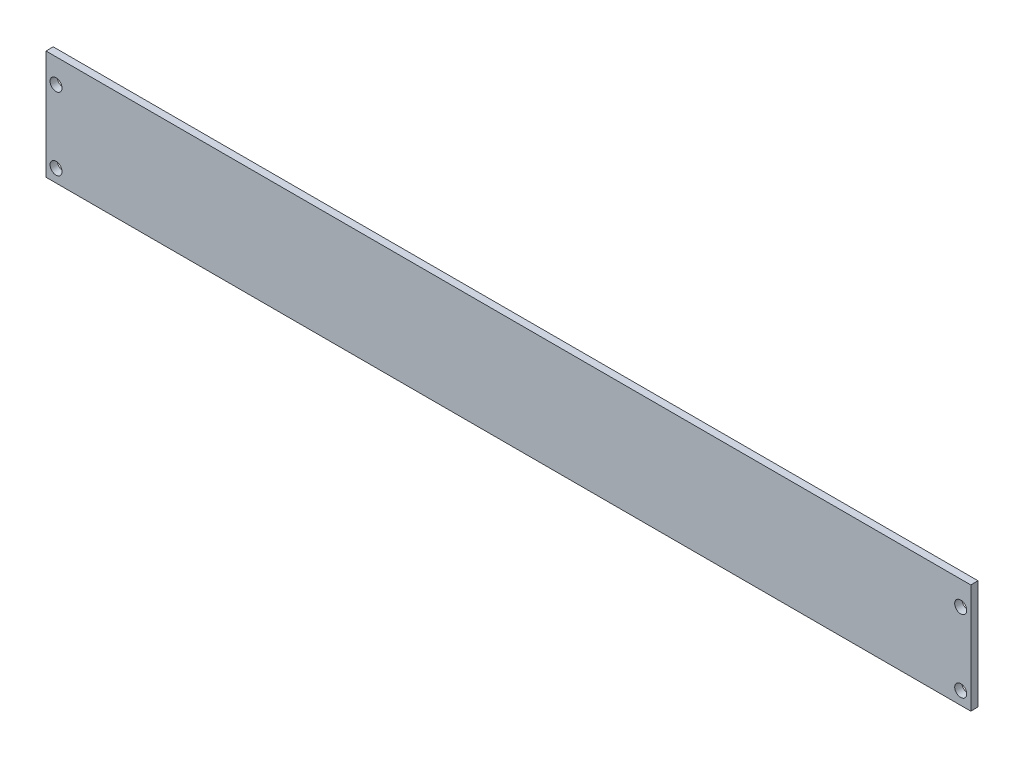
from build123d import *

# Parameters (mm, degrees)
SKETCH1_W           = 292.1
SKETCH1_H           = 34.544
SKETCH1_R           = 1.89865
BOSS_EXTRUDE1_DEPTH = 2.286


with BuildPart() as part:
    # Sketch1 → Boss-Extrude1 (new body)
    with BuildSketch(Plane.XY):
        Rectangle(SKETCH1_W, SKETCH1_H)
        with Locations((-142.875, 9.652)):
            Circle(SKETCH1_R, mode=Mode.SUBTRACT)
        with Locations((-142.875, -13.208)):
            Circle(SKETCH1_R, mode=Mode.SUBTRACT)
        with Locations((142.875, 9.652)):
            Circle(SKETCH1_R, mode=Mode.SUBTRACT)
        with Locations((142.875, -13.208)):
            Circle(SKETCH1_R, mode=Mode.SUBTRACT)
    extrude(amount=BOSS_EXTRUDE1_DEPTH)


solid = part.part
